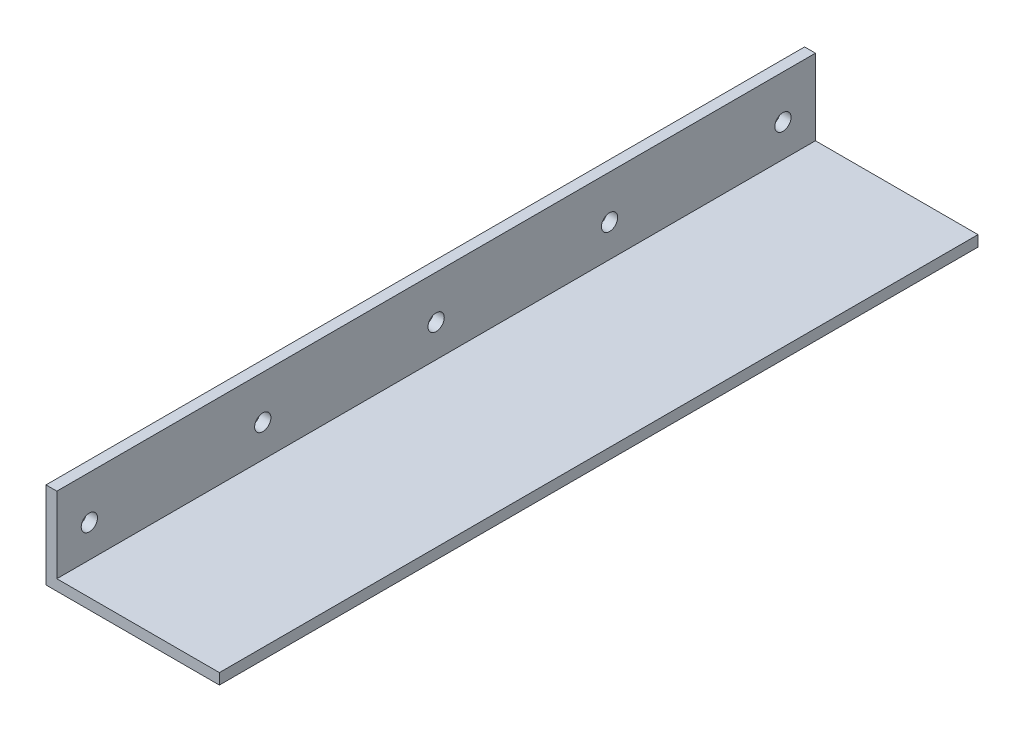
from build123d import *

# Parameters (mm, degrees)
BOSS_EXTRUDE1_DEPTH = 222.25
SKETCH2_R           = 2.38125
CUT_EXTRUDE1_DEPTH  = 230.392376726


with BuildPart() as part:
    # Sketch1 → Boss-Extrude1 (new body)
    with BuildSketch(Plane.XY):
        Polygon((0, 25.4), (0, 0), (50.8, 0), (50.8, 3.175), (3.175, 3.175), (3.175, 25.4), align=None)
    extrude(amount=BOSS_EXTRUDE1_DEPTH)

    # Sketch2 → Cut-Extrude1 (cut, through all)
    with BuildSketch(Plane.ZY):
        with Locations((212.725, 12.7)):
            Circle(SKETCH2_R)
        with Locations((161.925, 12.7)):
            Circle(SKETCH2_R)
        with Locations((111.125, 12.7)):
            Circle(SKETCH2_R)
        with Locations((60.325, 12.7)):
            Circle(SKETCH2_R)
        with Locations((9.525, 12.7)):
            Circle(SKETCH2_R)
        with Locations((-41.275, 12.7)):
            Circle(SKETCH2_R)
        with Locations((-92.075, 12.7)):
            Circle(SKETCH2_R)
        with Locations((-142.875, 12.7)):
            Circle(SKETCH2_R)
        with Locations((-193.675, 12.7)):
            Circle(SKETCH2_R)
        with Locations((-244.475, 12.7)):
            Circle(SKETCH2_R)
    extrude(amount=-CUT_EXTRUDE1_DEPTH, mode=Mode.SUBTRACT)


solid = part.part
